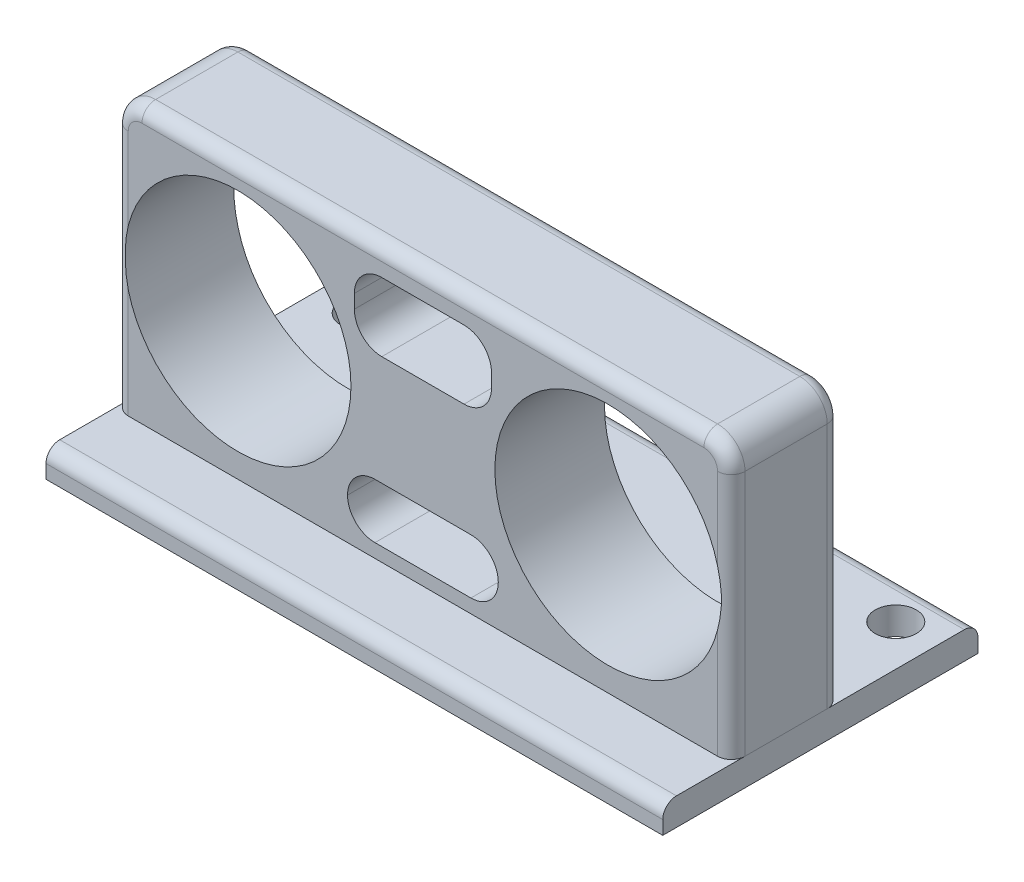
from build123d import *

# Parameters (mm, degrees)
CROQUIS1_W              = 45
CROQUIS1_H              = 20
CROQUIS1_R              = 8.25
SALIENTE_EXTRUIR1_DEPTH = 8
CROQUIS2_W              = 45
CROQUIS2_H              = 23
SALIENTE_EXTRUIR2_DEPTH = 2
CROQUIS4_W              = 11
CROQUIS4_H              = 4
CROQUIS4_W_2            = 10
CROQUIS4_H_2            = 5
CORTAR_EXTRUIR3_DEPTH   = 52.749396132
CROQUIS5_R              = 1.5
CORTAR_EXTRUIR4_DEPTH   = 51.931326313
REDONDEO1_R             = 2
REDONDEO2_R             = 2
REDONDEO3_R             = 1
REDONDEO5_R             = 1


# Some blends are built 0.0001 mm under size
with BuildPart() as part:
    # Croquis1 → Saliente-Extruir1 (new body)
    with BuildSketch(Plane.XY):
        with Locations((22.5, -10)):
            Rectangle(CROQUIS1_W, CROQUIS1_H)
        with Locations((9, -10)):
            Circle(CROQUIS1_R, mode=Mode.SUBTRACT)
        with Locations((36, -10)):
            Circle(CROQUIS1_R, mode=Mode.SUBTRACT)
    extrude(amount=SALIENTE_EXTRUIR1_DEPTH)

    # Croquis4 → Cortar-Extruir3 (cut, through all)
    with BuildSketch(Plane(origin=(0, 0, 0), x_dir=(-1, 0, 0), z_dir=(0, 0, -1))):
        with Locations((-22.5, -17)):
            Rectangle(CROQUIS4_W, CROQUIS4_H)
        with Locations((-22.5, -4.5)):
            Rectangle(CROQUIS4_W_2, CROQUIS4_H_2)
    extrude(amount=-CORTAR_EXTRUIR3_DEPTH, mode=Mode.SUBTRACT)

    # Redondeo1
    redondeo1_edges = [part.edges().sort_by_distance(p)[0] for p in [
        (17, -19, 4),
        (28, -15, 4),
        (17, -15, 4),
        (28, -19, 4),
    ]]
    fillet(redondeo1_edges, radius=REDONDEO1_R - 0.0001)  # a hair under: the kernel refuses the full size

    # Redondeo2
    redondeo2_edges = [part.edges().sort_by_distance(p)[0] for p in [
        (17.5, -7, 4),
        (27.5, -7, 4),
        (27.5, -2, 4),
        (17.5, -2, 4),
        (0, 0, 4),
        (45, 0, 4),
    ]]
    fillet(redondeo2_edges, radius=REDONDEO2_R)

    # Redondeo3
    # the kernel refuses this fillet: 1 mm, written as the material it takes off along each edge
    with BuildSketch(Plane(origin=(45, -2, 8), x_dir=(0, 0, -1), z_dir=(0, -1, 0)), Plane(origin=(45, -2, 0), x_dir=(-1, 0, 0), z_dir=(0, -1, 0)), Plane(origin=(0, -22.5, 0), x_dir=(1, 0, 0), z_dir=(0, 1, 0)), Plane(origin=(0, -22.5, 8), x_dir=(0, 0, -1), z_dir=(0, 1, 0))) as redondeo3_piece_1:
        with BuildLine():
            CenterArc((REDONDEO3_R, -REDONDEO3_R), REDONDEO3_R, 90, 90)
            Line((0, -REDONDEO3_R), (0, 0))
            Line((0, 0), (REDONDEO3_R, 0))
        make_face()
    extrude(amount=20.5, mode=Mode.SUBTRACT)
    with BuildSketch(Plane(origin=(2, 0, 0), x_dir=(0, -1, 0), z_dir=(1, 0, 0)), Plane(origin=(2, 0, 8), x_dir=(0, 0, -1), z_dir=(1, 0, 0))) as redondeo3_piece_2:
        with BuildLine():
            CenterArc((REDONDEO3_R, -REDONDEO3_R), REDONDEO3_R, 90, 90)
            Line((0, -REDONDEO3_R), (0, 0))
            Line((0, 0), (REDONDEO3_R, 0))
        make_face()
    extrude(amount=41, mode=Mode.SUBTRACT)
    with BuildSketch(Plane(origin=(2, -2, 0), x_dir=(0, 1, 0), z_dir=(1, 0, 0))) as redondeo3_piece_3:
        with BuildLine():
            CenterArc((2 - REDONDEO3_R, REDONDEO3_R), REDONDEO3_R, 270, 90)
            Line((2, REDONDEO3_R), (2, 0))
            Line((2, 0), (2 - REDONDEO3_R, 0))
        make_face()
    revolve(axis=Axis((2, -2, 0), (0, 0, 1)), revolution_arc=90, mode=Mode.SUBTRACT)
    with BuildSketch(Plane(origin=(43, -2, 0), x_dir=(0, 1, 0), z_dir=(-1, 0, 0))) as redondeo3_piece_4:
        with BuildLine():
            CenterArc((2 - REDONDEO3_R, -REDONDEO3_R), REDONDEO3_R, 0, 90)
            Line((2, -REDONDEO3_R), (2, 0))
            Line((2, 0), (2 - REDONDEO3_R, 0))
        make_face()
    revolve(axis=Axis((43, -2, 0), (0, 0, -1)), revolution_arc=90, mode=Mode.SUBTRACT)
    with BuildSketch(Plane(origin=(2, -2, 8), x_dir=(0, 1, 0), z_dir=(1, 0, 0))) as redondeo3_piece_5:
        with BuildLine():
            CenterArc((2 - REDONDEO3_R, -REDONDEO3_R), REDONDEO3_R, 0, 90)
            Line((2 - REDONDEO3_R, 0), (2, 0))
            Line((2, 0), (2, -REDONDEO3_R))
        make_face()
    revolve(axis=Axis((2, -2, 8), (0, 0, 1)), revolution_arc=90, mode=Mode.SUBTRACT)
    with BuildSketch(Plane(origin=(43, -2, 8), x_dir=(0, 1, 0), z_dir=(-1, 0, 0))) as redondeo3_piece_6:
        with BuildLine():
            CenterArc((2 - REDONDEO3_R, REDONDEO3_R), REDONDEO3_R, 270, 90)
            Line((2 - REDONDEO3_R, 0), (2, 0))
            Line((2, 0), (2, REDONDEO3_R))
        make_face()
    revolve(axis=Axis((43, -2, 8), (0, 0, -1)), revolution_arc=90, mode=Mode.SUBTRACT)


with BuildPart() as body_2:
    # Croquis2 → Saliente-Extruir2 (new body)
    with BuildSketch(Plane(origin=(0, -20, 0), x_dir=(-1, 0, 0), z_dir=(0, -1, 0))):
        with Locations((-22.5, -1.5)):
            Rectangle(CROQUIS2_W, CROQUIS2_H)
    extrude(amount=SALIENTE_EXTRUIR2_DEPTH)

    # Croquis5 → Cortar-Extruir4 (cut, through all)
    with BuildSketch(Plane(origin=(0, -20, 0), x_dir=(1, 0, 0), z_dir=(0, 1, 0))):
        with Locations(Location((3, 7, 0), (0, 0, 270))):
            Circle(CROQUIS5_R)
        with Locations(Location((42, 7, 0), (0, 0, 270))):
            Circle(CROQUIS5_R)
    extrude(amount=-CORTAR_EXTRUIR4_DEPTH, mode=Mode.SUBTRACT)

    # Redondeo5
    redondeo5_edges = [body_2.edges().sort_by_distance(p)[0] for p in [
        (22.5, -20, -10),
        (22.5, -20, 13),
    ]]
    fillet(redondeo5_edges, radius=REDONDEO5_R)


solid = Compound([part.part, body_2.part])
